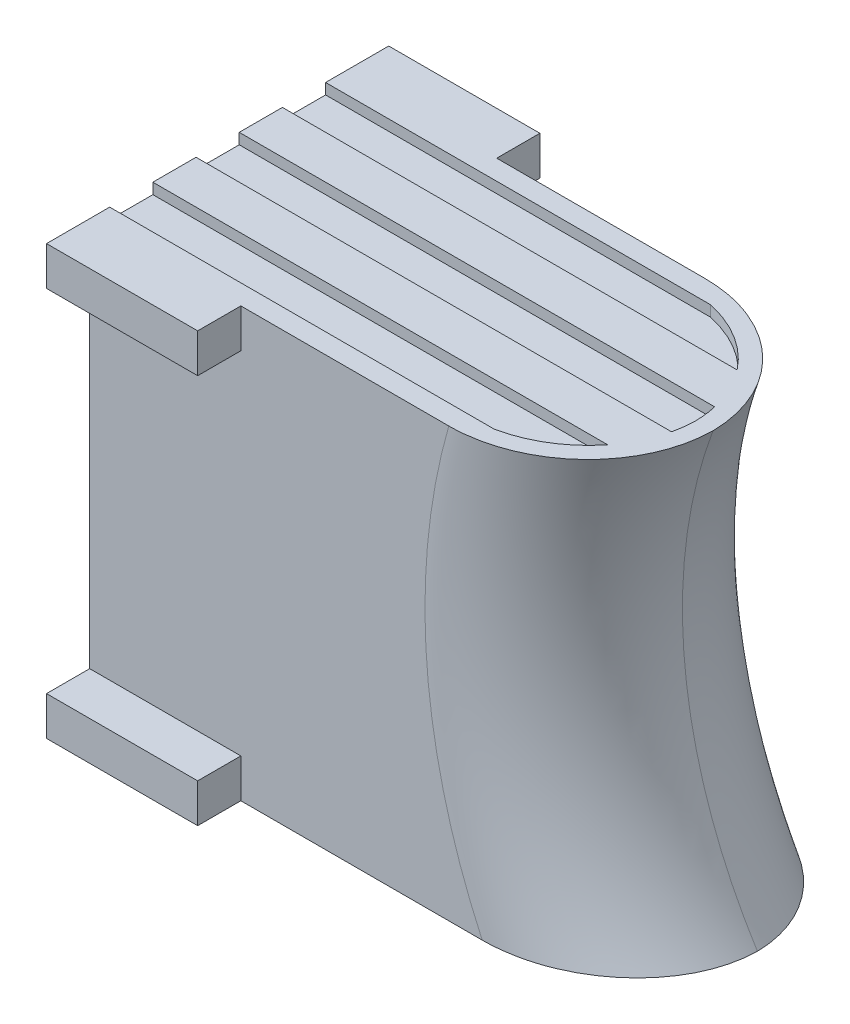
from build123d import *

# Parameters (mm, degrees)
BOSS_EXTRUDE1_DEPTH      = 11.85
BOSS_EXTRUDE2_DEPTH      = 2
BOSS_EXTRUDE2_DEPTH_BACK = 13.85
SKETCH2_W                = 7
SKETCH2_H                = 1.8
FILLET1_R                = 6
CUT_EXTRUDE1_DEPTH       = 0.5
CUT_EXTRUDE2_DEPTH       = 0.5
SKETCH6_R                = 2.65
SKETCH6_R_2              = 1.5
CUT_EXTRUDE3_DEPTH       = 10


with BuildPart() as part:
    # Sketch1 → Boss-Extrude1 (new body)
    with BuildSketch(Plane.XY):
        with BuildLine():
            Line((-40, 25.458108108), (-17.056531053, 25.458108108))
            ThreePointArc((-17.056531053, 25.458108108), (-18.352562381, 15.292302634), (-15, 5.608108108))
            Line((-15, 5.608108108), (-40, 5.608108108))
            Line((-40, 5.608108108), (-40, 25.458108108))
        make_face()
    extrude(amount=BOSS_EXTRUDE1_DEPTH)

    # Sketch2 → Boss-Extrude2 (add, two sides: drawn at the far end of the back side and taken through both)
    with BuildSketch(Plane(origin=(0, 0, 0), x_dir=(-1, 0, 0), z_dir=(0, 0, -1)).offset(-BOSS_EXTRUDE2_DEPTH_BACK)):
        with Locations((36.5, 6.508108108)):
            Rectangle(SKETCH2_W, SKETCH2_H)
        with Locations((36.5, 24.558108108)):
            Rectangle(SKETCH2_W, SKETCH2_H)
    extrude(amount=BOSS_EXTRUDE2_DEPTH + BOSS_EXTRUDE2_DEPTH_BACK)

    # Fillet1
    # the kernel refuses this fillet: 6 mm, written as the material it takes off along each edge
    with BuildSketch(Plane(origin=(4, 17.608108108, 0), x_dir=(-0.5195868737353421, 0.854417626598336, 0), z_dir=(0.854417626598336, 0.5195868737353421, 0))) as fillet1_piece_1:
        with BuildLine():
            CenterArc((22.472205054 + FILLET1_R, FILLET1_R), FILLET1_R, 180, 90)
            Line((22.472205054 + FILLET1_R, 0), (22.472205054, 0))
            Line((22.472205054, 0), (22.472205054, FILLET1_R))
        make_face()
    revolve(axis=Axis((4, 17.608108108, 0), (0, 0, 1)), revolution_arc=129.220802233, mode=Mode.SUBTRACT)
    with BuildSketch(Plane(origin=(4, 17.608108108, 11.85), x_dir=(-0.5195868737353421, 0.854417626598336, 0), z_dir=(0.854417626598336, 0.5195868737353421, 0))) as fillet1_piece_2:
        with BuildLine():
            CenterArc((22.472205054 + FILLET1_R, -FILLET1_R), FILLET1_R, 90, 90)
            Line((22.472205054, -FILLET1_R), (22.472205054, 0))
            Line((22.472205054, 0), (22.472205054 + FILLET1_R, 0))
        make_face()
    revolve(axis=Axis((4, 17.608108108, 11.85), (0, 0, 1)), revolution_arc=129.220802233, mode=Mode.SUBTRACT)

    # Sketch3 → Cut-Extrude1 (cut)
    with BuildSketch(Plane(origin=(0, 25.458108108, 0), x_dir=(1, 0, 0), z_dir=(0, 1, 0))):
        with BuildLine():
            Line((-40, -0.925), (-22.180241126, -0.925))
            add(Edge.make_bspline(
                [(-18.937526934, -2.925), (-19.013227922, -2.828512493), (-19.092514949, -2.73433601), (-19.290739716, -2.514692345), (-19.412819443, -2.391961398), (-19.796517456, -2.041181837), (-20.076726357, -1.829898628), (-20.674341708, -1.461904013), (-20.986869841, -1.307747212), (-21.591258811, -1.074971042), (-21.88385471, -0.988046248), (-22.180241126, -0.925)],
                knots=[0.393521627, 0.393521627, 0.393521627, 0.393521627, 0.4375, 0.4375, 0.5, 0.5, 0.625, 0.625, 0.75, 0.75, 0.857744944, 0.857744944, 0.857744944, 0.857744944], degree=3))
            Line((-18.937526934, -2.925), (-40, -2.925))
            Line((-40, -2.925), (-40, -0.925))
        make_face()
        with BuildLine():
            Line((-40, -4.925), (-17.97760602, -4.925))
            add(Edge.make_bspline(
                [(-17.857114262, -5.924996789), (-17.862389732, -5.585330665), (-17.903230985, -5.251628442), (-17.97760602, -4.925)],
                knots=[0, 0, 0, 0, 0.123073848, 0.123073848, 0.123073848, 0.123073848], degree=3))
            add(Edge.make_bspline(
                [(-17.977607618, -6.925), (-17.903108355, -6.597642735), (-17.862351336, -6.26181668), (-17.857114262, -5.924996789)],
                knots=[0.87810057, 0.87810057, 0.87810057, 0.87810057, 1, 1, 1, 1], degree=3))
            Line((-17.977607618, -6.925), (-40, -6.925))
            Line((-40, -6.925), (-40, -4.925))
        make_face()
        with BuildLine():
            Line((-40, -8.925), (-18.937485208, -8.925))
            add(Edge.make_bspline(
                [(-22.180090087, -10.925), (-22.058031588, -10.899076779), (-21.936790659, -10.869159263), (-21.647506804, -10.787627729), (-21.479286663, -10.731759415), (-20.988005272, -10.542973422), (-20.675799804, -10.388674568), (-20.230975304, -10.115240101), (-20.087143687, -10.017400974), (-19.80724707, -9.806950573), (-19.671333831, -9.694234428), (-19.322525279, -9.375728013), (-19.120509969, -9.15842179), (-18.937485208, -8.925)],
                knots=[0.142746843, 0.142746843, 0.142746843, 0.142746843, 0.1875, 0.1875, 0.25, 0.25, 0.375, 0.375, 0.4375, 0.4375, 0.5, 0.5, 0.607411447, 0.607411447, 0.607411447, 0.607411447], degree=3))
            Line((-22.180090087, -10.925), (-40, -10.925))
            Line((-40, -10.925), (-40, -8.925))
        make_face()
    extrude(amount=-CUT_EXTRUDE1_DEPTH, mode=Mode.SUBTRACT)

    # Sketch4 → Cut-Extrude2 (cut)
    with BuildSketch(Plane.XZ.offset(-5.608108108)):
        with BuildLine():
            Line((-18.937485208, 8.925), (-40, 8.925))
            Line((-40, 8.925), (-40, 10.925))
            Line((-40, 10.925), (-22.180090087, 10.925))
            add(Edge.make_bspline(
                [(-22.180090087, 10.925), (-22.058031589, 10.899076779), (-21.936790659, 10.869159263), (-21.647506804, 10.787627729), (-21.479286663, 10.731759415), (-20.988005272, 10.542973422), (-20.675799804, 10.388674568), (-20.230975304, 10.115240101), (-20.087143687, 10.017400974), (-19.80724707, 9.806950573), (-19.671333831, 9.694234428), (-19.322525301, 9.375728033), (-19.12051001, 9.158421833), (-18.937485208, 8.925)],
                knots=[0.392588564, 0.392588564, 0.392588564, 0.392588564, 0.437341721, 0.437341721, 0.499841721, 0.499841721, 0.624841721, 0.624841721, 0.687341721, 0.687341721, 0.749841721, 0.749841721, 0.857253157, 0.857253157, 0.857253157, 0.857253157], degree=3))
        make_face()
        with BuildLine():
            Line((-40, 6.925), (-17.977607618, 6.925))
            add(Edge.make_bspline(
                [(-17.977607618, 6.925), (-17.903108355, 6.597642735), (-17.862351336, 6.26181668), (-17.857114262, 5.924996789)],
                knots=[0, 0, 0, 0, 0.12189943, 0.12189943, 0.12189943, 0.12189943], degree=3))
            add(Edge.make_bspline(
                [(-17.857114262, 5.924996789), (-17.862389732, 5.585330665), (-17.903230985, 5.251628442), (-17.97760602, 4.925)],
                knots=[0.876926152, 0.876926152, 0.876926152, 0.876926152, 1, 1, 1, 1], degree=3))
            Line((-17.97760602, 4.925), (-40, 4.925))
            Line((-40, 4.925), (-40, 6.925))
        make_face()
        with BuildLine():
            Line((-40, 2.925), (-18.937526934, 2.925))
            add(Edge.make_bspline(
                [(-18.937526934, 2.925), (-19.013227922, 2.828512493), (-19.092514949, 2.73433601), (-19.290739716, 2.514692345), (-19.412819443, 2.391961398), (-19.796517456, 2.041181837), (-20.076726357, 1.829898628), (-20.674341708, 1.461904013), (-20.986869841, 1.307747212), (-21.591258789, 1.07497105), (-21.883854665, 0.988046261), (-22.180241126, 0.925)],
                knots=[0.142255064, 0.142255064, 0.142255064, 0.142255064, 0.186233438, 0.186233438, 0.248733438, 0.248733438, 0.373733438, 0.373733438, 0.498733438, 0.498733438, 0.606478373, 0.606478373, 0.606478373, 0.606478373], degree=3))
            Line((-22.180241126, 0.925), (-40, 0.925))
            Line((-40, 0.925), (-40, 2.925))
        make_face()
    extrude(amount=-CUT_EXTRUDE2_DEPTH, mode=Mode.SUBTRACT)

    # Sketch6 → Cut-Extrude3 (cut)
    with BuildSketch(Plane.ZY.offset(40)):
        with Locations((2.85, 15.458108108)):
            Circle(SKETCH6_R)
        with Locations((2.85, 15.458108108)):
            Circle(SKETCH6_R_2, mode=Mode.SUBTRACT)
    extrude(amount=-CUT_EXTRUDE3_DEPTH, mode=Mode.SUBTRACT)


solid = part.part
